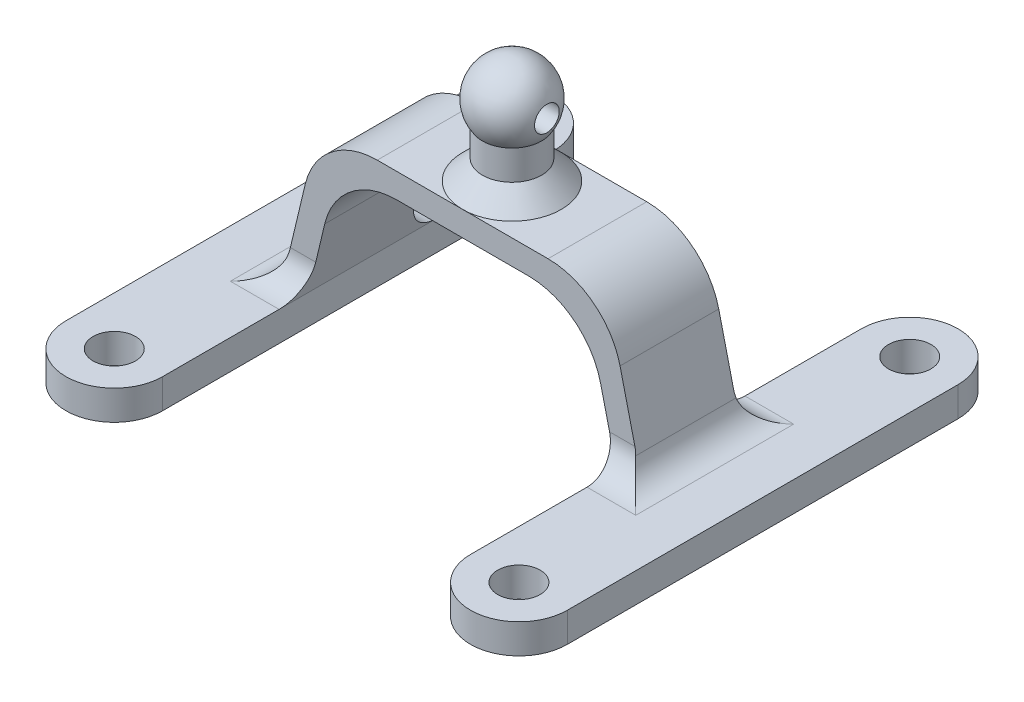
from build123d import *

# Parameters (mm, degrees)
SKETCH_4_R          = 4.9
SKETCH_4_R_2        = 2.15
EXTRUDE_1_DEPTH     = 3
EXTRUDE_2_DEPTH     = 5
FILLET_1_R          = 7.5
FILLET_2_R          = 3
SKETCH_8_R          = 3
EXTRUDE_3_DEPTH     = 5
SKETCH_10_R         = 1.25
CUT_EXTRUDE_1_DEPTH = 5
CHAMFER_1_SIZE      = 2


# Some blends are built 0.0001 mm under size
with BuildPart() as part:
    # ｽｹｯﾁ4 → ﾎﾞｽ - 押し出し1 (new body)
    # profile 1 of 6: a face of its own
    with BuildSketch(Plane(origin=(0, 20.928505024, 0), x_dir=(1, 0, 0), z_dir=(0, 1, 0))):
        with Locations((-20.5, 19.798989873)):
            Circle(SKETCH_4_R)
        with Locations(Location((-20.5, 19.798989873, 0), (0, 0, 270))):
            Circle(SKETCH_4_R_2, mode=Mode.SUBTRACT)
    # profile 2 of 6: a face of its own
    with BuildSketch(Plane(origin=(0, 20.928505024, 0), x_dir=(1, 0, 0), z_dir=(0, 1, 0))):
        with BuildLine():
            Line((-15.6, -19.798989873), (-15.6, 19.798989873))
            ThreePointArc((-15.6, 19.798989873), (-20.5, 14.898989873), (-25.4, 19.798989873))
            Line((-25.4, 19.798989873), (-25.4, -19.798989873))
            ThreePointArc((-25.4, -19.798989873), (-20.5, -14.898989873), (-15.6, -19.798989873))
        make_face()
    # profile 3 of 6: a face of its own
    with BuildSketch(Plane(origin=(0, 20.928505024, 0), x_dir=(1, 0, 0), z_dir=(0, 1, 0))):
        with Locations((-20.5, -19.798989873)):
            Circle(SKETCH_4_R)
        with Locations(Location((-20.5, -19.798989873, 0), (0, 0, 270))):
            Circle(SKETCH_4_R_2, mode=Mode.SUBTRACT)
    # profile 4 of 6: a face of its own
    with BuildSketch(Plane(origin=(0, 20.928505024, 0), x_dir=(1, 0, 0), z_dir=(0, 1, 0))):
        with BuildLine():
            Line((25.4, -19.798989873), (25.4, 19.798989873))
            ThreePointArc((25.4, 19.798989873), (20.5, 14.898989873), (15.6, 19.798989873))
            Line((15.6, 19.798989873), (15.6, -19.798989873))
            ThreePointArc((15.6, -19.798989873), (20.5, -14.898989873), (25.4, -19.798989873))
        make_face()
    # profile 5 of 6: a face of its own
    with BuildSketch(Plane(origin=(0, 20.928505024, 0), x_dir=(1, 0, 0), z_dir=(0, 1, 0))):
        with Locations((20.5, 19.798989873)):
            Circle(SKETCH_4_R)
        with Locations(Location((20.5, 19.798989873, 0), (0, 0, 270))):
            Circle(SKETCH_4_R_2, mode=Mode.SUBTRACT)
    # profile 6 of 6: a face of its own
    with BuildSketch(Plane(origin=(0, 20.928505024, 0), x_dir=(1, 0, 0), z_dir=(0, 1, 0))):
        with Locations((20.5, -19.798989873)):
            Circle(SKETCH_4_R)
        with Locations(Location((20.5, -19.798989873, 0), (0, 0, 270))):
            Circle(SKETCH_4_R_2, mode=Mode.SUBTRACT)
    extrude(amount=EXTRUDE_1_DEPTH)

    # ｽｹｯﾁ7 → ﾎﾞｽ - 押し出し2 (add, symmetric)
    with BuildSketch(Plane.XY):
        Polygon((-18.170197843, 23.928505024), (-15.6, 23.928505024), (-12.6, 36.5), (12.6, 36.5), (15.6, 23.928505024), (18.170197843, 23.928505024), (14.573610085, 39), (-14.573610085, 39), align=None)
    extrude(amount=EXTRUDE_2_DEPTH, both=True)

    # ﾌｨﾚｯﾄ1
    fillet_1_edges = [part.edges().sort_by_distance(p)[0] for p in [
        (14.573610085, 39, 0),
        (-14.573610085, 39, 0),
        (-12.6, 36.5, 0),
        (12.6, 36.5, 0),
    ]]
    fillet(fillet_1_edges, radius=FILLET_1_R)

    # ﾌｨﾚｯﾄ2
    # the kernel refuses this fillet: 3 mm, written as the material it adds along each edge
    with BuildSketch(Plane(origin=(-25.670197843, 23.928505024, -5), x_dir=(0, 1, 0), z_dir=(1, 0, 0))) as fillet_2_piece_1_section:
        with BuildLine():
            CenterArc((FILLET_2_R, -FILLET_2_R), FILLET_2_R, 90, 90)
            Line((0, -FILLET_2_R), (0, 0))
            Line((0, 0), (FILLET_2_R, 0))
        make_face()
    fillet_2_piece_1 = extrude(amount=10.070197843, mode=Mode.PRIVATE)
    fillet_2_piece_1 = split(fillet_2_piece_1, bisect_by=Plane(origin=(-15.521132181, 24.259000487, -5.703490697), z_dir=(-0.9726877666985287, 0.232117445520643, 0)), keep=Keep.TOP, mode=Mode.PRIVATE)
    fillet_2_piece_1 = split(fillet_2_piece_1, bisect_by=Plane(origin=(-17.952851598, 24.839294101, -5.703490697), z_dir=(0.9726877666985286, -0.23211744552064312, 0)), keep=Keep.TOP, mode=Mode.PRIVATE)
    add(fillet_2_piece_1)
    with BuildSketch(Plane(origin=(-25.670197843, 23.928505024, -5), x_dir=(0, 1, 0), z_dir=(1, 0, 0))) as fillet_2_piece_2_section:
        with BuildLine():
            CenterArc((FILLET_2_R, -FILLET_2_R), FILLET_2_R, 90, 90)
            Line((0, -FILLET_2_R), (0, 0))
            Line((0, 0), (FILLET_2_R, 0))
        make_face()
    fillet_2_piece_2 = extrude(amount=17.570197843, mode=Mode.PRIVATE)
    fillet_2_piece_2 = split(fillet_2_piece_2, bisect_by=Plane(origin=(-15.300371441, 25.184098001, -5.319417538), z_dir=(-0.9726877666985287, 0.232117445520643, 0)), keep=Keep.TOP, mode=Mode.PRIVATE)
    fillet_2_piece_2 = split(fillet_2_piece_2, bisect_by=Plane(origin=(-15.6, 25.218859179, -5.319417538), z_dir=(1, 0, 0)), keep=Keep.TOP, mode=Mode.PRIVATE)
    add(fillet_2_piece_2)
    with BuildSketch(Plane(origin=(-18.170197843, 23.928505024, 5), x_dir=(-1, 0, 0), z_dir=(0, 0, -1)), Plane(origin=(18.170197843, 23.928505024, -5), x_dir=(1, 0, 0), z_dir=(0, 0, 1))) as fillet_2_piece_3:
        with BuildLine():
            CenterArc((FILLET_2_R * 0.789444034118, FILLET_2_R), FILLET_2_R, 193.421766737, 76.578233263)
            Line((-FILLET_2_R * 0.183243732581, FILLET_2_R * 0.767882554479), (0, 0))
            Line((0, 0), (FILLET_2_R * 0.789444034118, 0))
        make_face()
    extrude(amount=10)
    with BuildSketch(Plane(origin=(8.1, 23.928505024, -5), x_dir=(0, 1, 0), z_dir=(1, 0, 0))) as fillet_2_piece_4_section:
        with BuildLine():
            CenterArc((FILLET_2_R, -FILLET_2_R), FILLET_2_R, 90, 90)
            Line((0, -FILLET_2_R), (0, 0))
            Line((0, 0), (FILLET_2_R, 0))
        make_face()
    fillet_2_piece_4 = extrude(amount=17.570197843, mode=Mode.PRIVATE)
    fillet_2_piece_4 = split(fillet_2_piece_4, bisect_by=Plane(origin=(15.300371441, 25.184098001, -5.319417538), z_dir=(0.9726877666985287, 0.23211744552064287, 0)), keep=Keep.TOP, mode=Mode.PRIVATE)
    fillet_2_piece_4 = split(fillet_2_piece_4, bisect_by=Plane(origin=(15.6, 25.218859179, -5.319417538), z_dir=(-1, 0, 0)), keep=Keep.TOP, mode=Mode.PRIVATE)
    add(fillet_2_piece_4)
    with BuildSketch(Plane(origin=(15.6, 23.928505024, -5), x_dir=(0, 1, 0), z_dir=(1, 0, 0))) as fillet_2_piece_5_section:
        with BuildLine():
            CenterArc((FILLET_2_R, -FILLET_2_R), FILLET_2_R, 90, 90)
            Line((0, -FILLET_2_R), (0, 0))
            Line((0, 0), (FILLET_2_R, 0))
        make_face()
    fillet_2_piece_5 = extrude(amount=10.070197843, mode=Mode.PRIVATE)
    fillet_2_piece_5 = split(fillet_2_piece_5, bisect_by=Plane(origin=(15.521132181, 24.259000487, -5.703490697), z_dir=(0.9726877666985287, 0.23211744552064287, 0)), keep=Keep.TOP, mode=Mode.PRIVATE)
    fillet_2_piece_5 = split(fillet_2_piece_5, bisect_by=Plane(origin=(17.952851598, 24.839294101, -5.703490697), z_dir=(-0.9726877666985286, -0.23211744552064312, 0)), keep=Keep.TOP, mode=Mode.PRIVATE)
    add(fillet_2_piece_5)
    with BuildSketch(Plane(origin=(-25.670197843, 23.928505024, 5), x_dir=(0, 1, 0), z_dir=(1, 0, 0))) as fillet_2_piece_6_section:
        with BuildLine():
            CenterArc((FILLET_2_R, FILLET_2_R), FILLET_2_R, 180, 90)
            Line((0, FILLET_2_R), (0, 0))
            Line((0, 0), (FILLET_2_R, 0))
        make_face()
    fillet_2_piece_6 = extrude(amount=10.070197843, mode=Mode.PRIVATE)
    fillet_2_piece_6 = split(fillet_2_piece_6, bisect_by=Plane(origin=(-15.521132181, 24.259000487, 5.703490697), z_dir=(-0.9726877666985287, 0.232117445520643, 0)), keep=Keep.TOP, mode=Mode.PRIVATE)
    fillet_2_piece_6 = split(fillet_2_piece_6, bisect_by=Plane(origin=(-17.952851598, 24.839294101, 5.703490697), z_dir=(0.9726877666985286, -0.23211744552064312, 0)), keep=Keep.TOP, mode=Mode.PRIVATE)
    add(fillet_2_piece_6)
    with BuildSketch(Plane(origin=(-25.670197843, 23.928505024, 5), x_dir=(0, 1, 0), z_dir=(1, 0, 0))) as fillet_2_piece_7_section:
        with BuildLine():
            CenterArc((FILLET_2_R, FILLET_2_R), FILLET_2_R, 180, 90)
            Line((0, FILLET_2_R), (0, 0))
            Line((0, 0), (FILLET_2_R, 0))
        make_face()
    fillet_2_piece_7 = extrude(amount=17.570197843, mode=Mode.PRIVATE)
    fillet_2_piece_7 = split(fillet_2_piece_7, bisect_by=Plane(origin=(-15.300371441, 25.184098001, 5.319417538), z_dir=(-0.9726877666985287, 0.232117445520643, 0)), keep=Keep.TOP, mode=Mode.PRIVATE)
    fillet_2_piece_7 = split(fillet_2_piece_7, bisect_by=Plane(origin=(-15.6, 25.218859179, 5.319417538), z_dir=(1, 0, 0)), keep=Keep.TOP, mode=Mode.PRIVATE)
    add(fillet_2_piece_7)
    with BuildSketch(Plane(origin=(8.1, 23.928505024, 5), x_dir=(0, 1, 0), z_dir=(1, 0, 0))) as fillet_2_piece_8_section:
        with BuildLine():
            CenterArc((FILLET_2_R, FILLET_2_R), FILLET_2_R, 180, 90)
            Line((0, FILLET_2_R), (0, 0))
            Line((0, 0), (FILLET_2_R, 0))
        make_face()
    fillet_2_piece_8 = extrude(amount=17.570197843, mode=Mode.PRIVATE)
    fillet_2_piece_8 = split(fillet_2_piece_8, bisect_by=Plane(origin=(15.300371441, 25.184098001, 5.319417538), z_dir=(0.9726877666985287, 0.23211744552064287, 0)), keep=Keep.TOP, mode=Mode.PRIVATE)
    fillet_2_piece_8 = split(fillet_2_piece_8, bisect_by=Plane(origin=(15.6, 25.218859179, 5.319417538), z_dir=(-1, 0, 0)), keep=Keep.TOP, mode=Mode.PRIVATE)
    add(fillet_2_piece_8)
    with BuildSketch(Plane(origin=(15.6, 23.928505024, 5), x_dir=(0, 1, 0), z_dir=(1, 0, 0))) as fillet_2_piece_9_section:
        with BuildLine():
            CenterArc((FILLET_2_R, FILLET_2_R), FILLET_2_R, 180, 90)
            Line((0, FILLET_2_R), (0, 0))
            Line((0, 0), (FILLET_2_R, 0))
        make_face()
    fillet_2_piece_9 = extrude(amount=10.070197843, mode=Mode.PRIVATE)
    fillet_2_piece_9 = split(fillet_2_piece_9, bisect_by=Plane(origin=(15.521132181, 24.259000487, 5.703490697), z_dir=(0.9726877666985287, 0.23211744552064287, 0)), keep=Keep.TOP, mode=Mode.PRIVATE)
    fillet_2_piece_9 = split(fillet_2_piece_9, bisect_by=Plane(origin=(17.952851598, 24.839294101, 5.703490697), z_dir=(-0.9726877666985286, -0.23211744552064312, 0)), keep=Keep.TOP, mode=Mode.PRIVATE)
    add(fillet_2_piece_9)
    with BuildSketch(Plane(origin=(-25.670197843, 23.928505024, -5), x_dir=(0, 1, 0), z_dir=(1, 0, 0))) as fillet_2_piece_10a_section:
        with BuildLine():
            CenterArc((FILLET_2_R, -FILLET_2_R), FILLET_2_R, 90, 90)
            Line((0, -FILLET_2_R), (0, 0))
            Line((0, 0), (FILLET_2_R, 0))
        make_face()
    fillet_2_piece_10a = extrude(amount=10.070197843, mode=Mode.PRIVATE)
    fillet_2_piece_10a = split(fillet_2_piece_10a, bisect_by=Plane(origin=(-18.204116429, 23.786369246, -5.671207776), z_dir=(-0.9726877666985286, 0.23211744552064312, 0)), keep=Keep.TOP, mode=Mode.PRIVATE)
    fillet_2_piece_10a = split(fillet_2_piece_10a, bisect_by=Plane(origin=(-25.4, 24.621194187, -5.671207776), z_dir=(1, 0, 0)), keep=Keep.TOP, mode=Mode.PRIVATE)
    with BuildSketch(Plane(origin=(-18.170197843, 23.928505024, 5), x_dir=(-1, 0, 0), z_dir=(0, 0, -1))) as fillet_2_piece_10b_section:
        with BuildLine():
            CenterArc((FILLET_2_R * 0.789444034118, FILLET_2_R), FILLET_2_R, 193.421766737, 76.578233263)
            Line((-FILLET_2_R * 0.183243732581, FILLET_2_R * 0.767882554479), (0, 0))
            Line((0, 0), (FILLET_2_R * 0.789444034118, 0))
        make_face()
    fillet_2_piece_10b = extrude(amount=15.920830256, mode=Mode.PRIVATE)
    fillet_2_piece_10b = split(fillet_2_piece_10b, bisect_by=Plane(origin=(-18.572539965, 24.43815752, -5), z_dir=(0, 0, -1)), keep=Keep.TOP, mode=Mode.PRIVATE)
    fillet_2_piece_10 = fillet_2_piece_10a & fillet_2_piece_10b
    add(fillet_2_piece_10)
    with BuildSketch(Plane(origin=(-25.670197843, 23.928505024, 5), x_dir=(0, 1, 0), z_dir=(1, 0, 0))) as fillet_2_piece_11a_section:
        with BuildLine():
            CenterArc((FILLET_2_R, FILLET_2_R), FILLET_2_R, 180, 90)
            Line((0, FILLET_2_R), (0, 0))
            Line((0, 0), (FILLET_2_R, 0))
        make_face()
    fillet_2_piece_11a = extrude(amount=10.070197843, mode=Mode.PRIVATE)
    fillet_2_piece_11a = split(fillet_2_piece_11a, bisect_by=Plane(origin=(-18.204116429, 23.786369246, 5.671207776), z_dir=(-0.9726877666985286, 0.23211744552064312, 0)), keep=Keep.TOP, mode=Mode.PRIVATE)
    fillet_2_piece_11a = split(fillet_2_piece_11a, bisect_by=Plane(origin=(-25.4, 24.621194187, 5.671207776), z_dir=(1, 0, 0)), keep=Keep.TOP, mode=Mode.PRIVATE)
    with BuildSketch(Plane(origin=(-18.170197843, 23.928505024, 10.920830256), x_dir=(-1, 0, 0), z_dir=(0, 0, -1))) as fillet_2_piece_11b_section:
        with BuildLine():
            CenterArc((FILLET_2_R * 0.789444034118, FILLET_2_R), FILLET_2_R, 193.421766737, 76.578233263)
            Line((-FILLET_2_R * 0.183243732581, FILLET_2_R * 0.767882554479), (0, 0))
            Line((0, 0), (FILLET_2_R * 0.789444034118, 0))
        make_face()
    fillet_2_piece_11b = extrude(amount=15.920830256, mode=Mode.PRIVATE)
    fillet_2_piece_11b = split(fillet_2_piece_11b, bisect_by=Plane(origin=(-18.572539965, 24.43815752, 5), z_dir=(0, 0, 1)), keep=Keep.TOP, mode=Mode.PRIVATE)
    fillet_2_piece_11 = fillet_2_piece_11a & fillet_2_piece_11b
    add(fillet_2_piece_11)
    with BuildSketch(Plane(origin=(15.6, 23.928505024, -5), x_dir=(0, 1, 0), z_dir=(1, 0, 0))) as fillet_2_piece_12a_section:
        with BuildLine():
            CenterArc((FILLET_2_R, -FILLET_2_R), FILLET_2_R, 90, 90)
            Line((0, -FILLET_2_R), (0, 0))
            Line((0, 0), (FILLET_2_R, 0))
        make_face()
    fillet_2_piece_12a = extrude(amount=10.070197843, mode=Mode.PRIVATE)
    fillet_2_piece_12a = split(fillet_2_piece_12a, bisect_by=Plane(origin=(18.204116429, 23.786369246, -5.671207776), z_dir=(0.9726877666985286, 0.23211744552064312, 0)), keep=Keep.TOP, mode=Mode.PRIVATE)
    fillet_2_piece_12a = split(fillet_2_piece_12a, bisect_by=Plane(origin=(25.4, 24.621194187, -5.671207776), z_dir=(-1, 0, 0)), keep=Keep.TOP, mode=Mode.PRIVATE)
    with BuildSketch(Plane(origin=(18.170197843, 23.928505024, -10.920830256), x_dir=(1, 0, 0), z_dir=(0, 0, 1))) as fillet_2_piece_12b_section:
        with BuildLine():
            CenterArc((FILLET_2_R * 0.789444034118, FILLET_2_R), FILLET_2_R, 193.421766737, 76.578233263)
            Line((-FILLET_2_R * 0.183243732581, FILLET_2_R * 0.767882554479), (0, 0))
            Line((0, 0), (FILLET_2_R * 0.789444034118, 0))
        make_face()
    fillet_2_piece_12b = extrude(amount=15.920830256, mode=Mode.PRIVATE)
    fillet_2_piece_12b = split(fillet_2_piece_12b, bisect_by=Plane(origin=(18.572539965, 24.43815752, -5), z_dir=(0, 0, -1)), keep=Keep.TOP, mode=Mode.PRIVATE)
    fillet_2_piece_12 = fillet_2_piece_12a & fillet_2_piece_12b
    add(fillet_2_piece_12)
    with BuildSketch(Plane(origin=(15.6, 23.928505024, 5), x_dir=(0, 1, 0), z_dir=(1, 0, 0))) as fillet_2_piece_13a_section:
        with BuildLine():
            CenterArc((FILLET_2_R, FILLET_2_R), FILLET_2_R, 180, 90)
            Line((0, FILLET_2_R), (0, 0))
            Line((0, 0), (FILLET_2_R, 0))
        make_face()
    fillet_2_piece_13a = extrude(amount=10.070197843, mode=Mode.PRIVATE)
    fillet_2_piece_13a = split(fillet_2_piece_13a, bisect_by=Plane(origin=(18.204116429, 23.786369246, 5.671207776), z_dir=(0.9726877666985286, 0.23211744552064312, 0)), keep=Keep.TOP, mode=Mode.PRIVATE)
    fillet_2_piece_13a = split(fillet_2_piece_13a, bisect_by=Plane(origin=(25.4, 24.621194187, 5.671207776), z_dir=(-1, 0, 0)), keep=Keep.TOP, mode=Mode.PRIVATE)
    with BuildSketch(Plane(origin=(18.170197843, 23.928505024, -5), x_dir=(1, 0, 0), z_dir=(0, 0, 1))) as fillet_2_piece_13b_section:
        with BuildLine():
            CenterArc((FILLET_2_R * 0.789444034118, FILLET_2_R), FILLET_2_R, 193.421766737, 76.578233263)
            Line((-FILLET_2_R * 0.183243732581, FILLET_2_R * 0.767882554479), (0, 0))
            Line((0, 0), (FILLET_2_R * 0.789444034118, 0))
        make_face()
    fillet_2_piece_13b = extrude(amount=15.920830256, mode=Mode.PRIVATE)
    fillet_2_piece_13b = split(fillet_2_piece_13b, bisect_by=Plane(origin=(18.572539965, 24.43815752, 5), z_dir=(0, 0, 1)), keep=Keep.TOP, mode=Mode.PRIVATE)
    fillet_2_piece_13 = fillet_2_piece_13a & fillet_2_piece_13b
    add(fillet_2_piece_13)

    # ｽｹｯﾁ8 → ﾎﾞｽ - 押し出し3 (add)
    with BuildSketch(Plane(origin=(0, 39, 0), x_dir=(1, 0, 0), z_dir=(0, 1, 0))):
        with Locations(Location((0, 0, 0), (0, 0, 270))):
            Circle(SKETCH_8_R)
    extrude(amount=EXTRUDE_3_DEPTH)

    # ｽｹｯﾁ9 one side → 回転1 (revolve)
    with BuildSketch(Plane.XY):
        with BuildLine():
            ThreePointArc((0, 42.5), (2.651650429, 43.59834957), (3.75, 46.25))
            ThreePointArc((3.75, 46.25), (2.651650429, 48.901650429), (0, 50))
            Line((0, 50), (0, 42.5))
        make_face()
    revolve(axis=Axis((0, 50, 0), (0, -1, 0)))

    # ｽｹｯﾁ10 → ｶｯﾄ - 押し出し1 (cut, symmetric)
    with BuildSketch(Plane(origin=(0, 0, 0), x_dir=(0, 0, -1), z_dir=(1, 0, 0))):
        with Locations((0, 46.25)):
            Circle(SKETCH_10_R)
    extrude(amount=CUT_EXTRUDE_1_DEPTH, both=True, mode=Mode.SUBTRACT)

    # 面取り1
    chamfer_1_edges = [part.edges().sort_by_distance(p)[0] for p in [
        (0, 39, -3),
    ]]
    chamfer(chamfer_1_edges, length=CHAMFER_1_SIZE - 0.0001)  # a hair under: the kernel refuses the full size


solid = part.part
